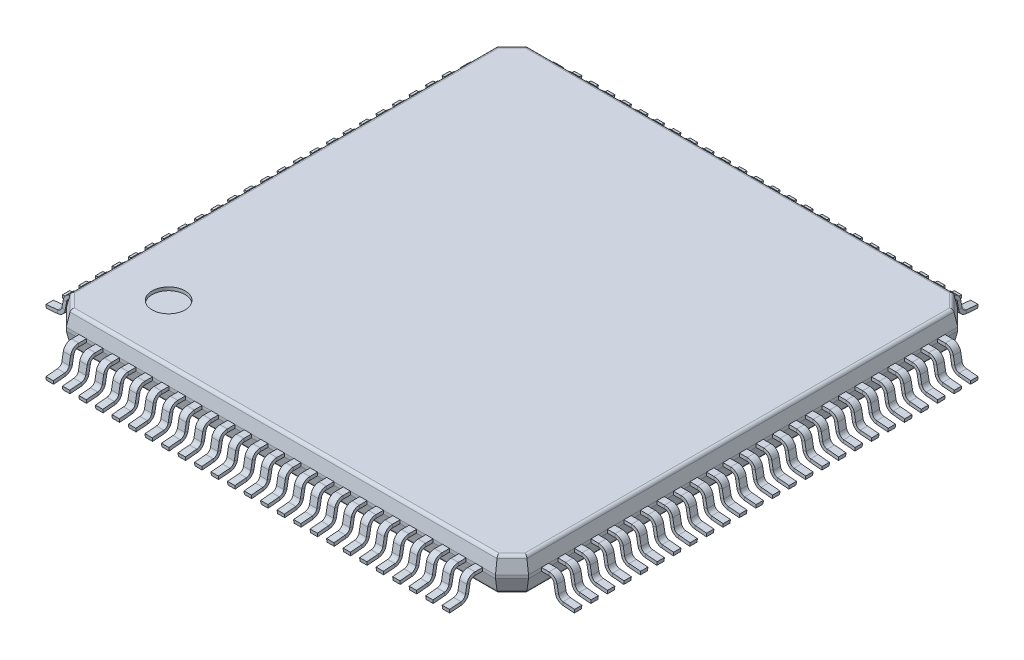
from build123d import *
from OCP.BRepFilletAPI import BRepFilletAPI_MakeChamfer

# Parameters (mm, degrees)
EXTRUDE_1_DEPTH           = 1
CHAMFER_1_SIZE            = 0.45
CHAMFER_1_SIZE2           = 0.095650453
CHAMFER_2_SIZE            = 0.45
CHAMFER_2_SIZE2           = 0.095650453
FILLET_1_R                = 0.1
SKETCH_2_R                = 0.5
CUT_EXTRUDE_1_DEPTH       = 0.1
SKETCH_4_W                = 0.22
SKETCH_4_H                = 0.1
PATTERN_LINEAR_1_COUNT    = 25
PATTERN_LINEAR_1_PITCH    = 0.5
MIRROR_1_COPY_1_SKETCH_W  = 0.22
MIRROR_1_COPY_1_SKETCH_H  = 0.1
MIRROR_1_COPY_2_SKETCH_W  = 0.22
MIRROR_1_COPY_2_SKETCH_H  = 0.1
MIRROR_1_COPY_3_SKETCH_W  = 0.22
MIRROR_1_COPY_3_SKETCH_H  = 0.1
MIRROR_1_COPY_4_SKETCH_W  = 0.22
MIRROR_1_COPY_4_SKETCH_H  = 0.1
MIRROR_1_COPY_5_SKETCH_W  = 0.22
MIRROR_1_COPY_5_SKETCH_H  = 0.1
MIRROR_1_COPY_6_SKETCH_W  = 0.22
MIRROR_1_COPY_6_SKETCH_H  = 0.1
MIRROR_1_COPY_7_SKETCH_W  = 0.22
MIRROR_1_COPY_7_SKETCH_H  = 0.1
MIRROR_1_COPY_8_SKETCH_W  = 0.22
MIRROR_1_COPY_8_SKETCH_H  = 0.1
MIRROR_1_COPY_9_SKETCH_W  = 0.22
MIRROR_1_COPY_9_SKETCH_H  = 0.1
MIRROR_1_COPY_10_SKETCH_W = 0.22
MIRROR_1_COPY_10_SKETCH_H = 0.1
MIRROR_1_COPY_11_SKETCH_W = 0.22
MIRROR_1_COPY_11_SKETCH_H = 0.1
MIRROR_1_COPY_12_SKETCH_W = 0.22
MIRROR_1_COPY_12_SKETCH_H = 0.1
MIRROR_1_COPY_13_SKETCH_W = 0.22
MIRROR_1_COPY_13_SKETCH_H = 0.1
MIRROR_1_COPY_14_SKETCH_W = 0.22
MIRROR_1_COPY_14_SKETCH_H = 0.1
MIRROR_1_COPY_15_SKETCH_W = 0.22
MIRROR_1_COPY_15_SKETCH_H = 0.1
MIRROR_1_COPY_16_SKETCH_W = 0.22
MIRROR_1_COPY_16_SKETCH_H = 0.1
MIRROR_1_COPY_17_SKETCH_W = 0.22
MIRROR_1_COPY_17_SKETCH_H = 0.1
MIRROR_1_COPY_18_SKETCH_W = 0.22
MIRROR_1_COPY_18_SKETCH_H = 0.1
MIRROR_1_COPY_19_SKETCH_W = 0.22
MIRROR_1_COPY_19_SKETCH_H = 0.1
MIRROR_1_COPY_20_SKETCH_W = 0.22
MIRROR_1_COPY_20_SKETCH_H = 0.1
MIRROR_1_COPY_21_SKETCH_W = 0.22
MIRROR_1_COPY_21_SKETCH_H = 0.1
MIRROR_1_COPY_22_SKETCH_W = 0.22
MIRROR_1_COPY_22_SKETCH_H = 0.1
MIRROR_1_COPY_23_SKETCH_W = 0.22
MIRROR_1_COPY_23_SKETCH_H = 0.1
MIRROR_1_COPY_24_SKETCH_W = 0.22
MIRROR_1_COPY_24_SKETCH_H = 0.1
PATTERN_LINEAR_2_COUNT    = 25
PATTERN_LINEAR_2_PITCH    = 0.5


with BuildPart() as part:
    # Эскиз1 → Бобышка-Вытянуть1 (new body)
    with BuildSketch(Plane(origin=(0, 0, 0), x_dir=(1, 0, 0), z_dir=(0, 1, 0))):
        Polygon((0, 13.5), (0.5, 14), (13.5, 14), (14, 13.5), (14, 0.5), (13.5, 0), (0.5, 0), (0, 0.5), align=None)
    extrude(amount=EXTRUDE_1_DEPTH)

    # Фаска1: one chamfer whose edges measure the first distance from different faces: ONE call of the kernel's chamfer builder (chamfer() names one face for all edges)
    chamfer_1_edges_1 = [part.edges().sort_by_distance(p)[0] for p in [
        (0.25, 1, -13.75),
    ]]
    chamfer_1_side_1 = [part.faces().sort_by_distance(p)[0] for p in [
        (0.25, 0.5, -13.75),
    ]]
    chamfer_1_edges_2 = [part.edges().sort_by_distance(p)[0] for p in [
        (7, 1, -14),
    ]]
    chamfer_1_side_2 = [part.faces().sort_by_distance(p)[0] for p in [
        (7, 0.5, -14),
    ]]
    chamfer_1_edges_3 = [part.edges().sort_by_distance(p)[0] for p in [
        (13.75, 1, -13.75),
    ]]
    chamfer_1_side_3 = [part.faces().sort_by_distance(p)[0] for p in [
        (13.75, 0.5, -13.75),
    ]]
    chamfer_1_edges_4 = [part.edges().sort_by_distance(p)[0] for p in [
        (14, 1, -7),
    ]]
    chamfer_1_side_4 = [part.faces().sort_by_distance(p)[0] for p in [
        (14, 0.5, -7),
    ]]
    chamfer_1_edges_5 = [part.edges().sort_by_distance(p)[0] for p in [
        (13.75, 1, -0.25),
    ]]
    chamfer_1_side_5 = [part.faces().sort_by_distance(p)[0] for p in [
        (13.75, 0.5, -0.25),
    ]]
    chamfer_1_edges_6 = [part.edges().sort_by_distance(p)[0] for p in [
        (7, 1, 0),
    ]]
    chamfer_1_side_6 = [part.faces().sort_by_distance(p)[0] for p in [
        (7, 0.5, 0),
    ]]
    chamfer_1_edges_7 = [part.edges().sort_by_distance(p)[0] for p in [
        (0.25, 1, -0.25),
    ]]
    chamfer_1_side_7 = [part.faces().sort_by_distance(p)[0] for p in [
        (0.25, 0.5, -0.25),
    ]]
    chamfer_1_edges_8 = [part.edges().sort_by_distance(p)[0] for p in [
        (0, 1, -7),
    ]]
    chamfer_1_side_8 = [part.faces().sort_by_distance(p)[0] for p in [
        (0, 0.5, -7),
    ]]
    chamfer_1 = BRepFilletAPI_MakeChamfer(part.part.solid().wrapped)
    for e in chamfer_1_edges_1:
        chamfer_1.Add(CHAMFER_1_SIZE, CHAMFER_1_SIZE2, e.wrapped, chamfer_1_side_1[0].wrapped)  # the first distance lies on this face
    for e in chamfer_1_edges_2:
        chamfer_1.Add(CHAMFER_1_SIZE, CHAMFER_1_SIZE2, e.wrapped, chamfer_1_side_2[0].wrapped)  # the first distance lies on this face
    for e in chamfer_1_edges_3:
        chamfer_1.Add(CHAMFER_1_SIZE, CHAMFER_1_SIZE2, e.wrapped, chamfer_1_side_3[0].wrapped)  # the first distance lies on this face
    for e in chamfer_1_edges_4:
        chamfer_1.Add(CHAMFER_1_SIZE, CHAMFER_1_SIZE2, e.wrapped, chamfer_1_side_4[0].wrapped)  # the first distance lies on this face
    for e in chamfer_1_edges_5:
        chamfer_1.Add(CHAMFER_1_SIZE, CHAMFER_1_SIZE2, e.wrapped, chamfer_1_side_5[0].wrapped)  # the first distance lies on this face
    for e in chamfer_1_edges_6:
        chamfer_1.Add(CHAMFER_1_SIZE, CHAMFER_1_SIZE2, e.wrapped, chamfer_1_side_6[0].wrapped)  # the first distance lies on this face
    for e in chamfer_1_edges_7:
        chamfer_1.Add(CHAMFER_1_SIZE, CHAMFER_1_SIZE2, e.wrapped, chamfer_1_side_7[0].wrapped)  # the first distance lies on this face
    for e in chamfer_1_edges_8:
        chamfer_1.Add(CHAMFER_1_SIZE, CHAMFER_1_SIZE2, e.wrapped, chamfer_1_side_8[0].wrapped)  # the first distance lies on this face
    add(Compound.cast(chamfer_1.Shape()), mode=Mode.REPLACE)

    # Фаска2: one chamfer whose edges measure the first distance from different faces: ONE call of the kernel's chamfer builder (chamfer() names one face for all edges)
    chamfer_2_edges_1 = [part.edges().sort_by_distance(p)[0] for p in [
        (0.25, 0, -0.25),
    ]]
    chamfer_2_side_1 = [part.faces().sort_by_distance(p)[0] for p in [
        (0.25, 0.275, -0.25),
    ]]
    chamfer_2_edges_2 = [part.edges().sort_by_distance(p)[0] for p in [
        (7, 0, 0),
    ]]
    chamfer_2_side_2 = [part.faces().sort_by_distance(p)[0] for p in [
        (7, 0.275, 0),
    ]]
    chamfer_2_edges_3 = [part.edges().sort_by_distance(p)[0] for p in [
        (13.75, 0, -0.25),
    ]]
    chamfer_2_side_3 = [part.faces().sort_by_distance(p)[0] for p in [
        (13.75, 0.275, -0.25),
    ]]
    chamfer_2_edges_4 = [part.edges().sort_by_distance(p)[0] for p in [
        (14, 0, -7),
    ]]
    chamfer_2_side_4 = [part.faces().sort_by_distance(p)[0] for p in [
        (14, 0.275, -7),
    ]]
    chamfer_2_edges_5 = [part.edges().sort_by_distance(p)[0] for p in [
        (13.75, 0, -13.75),
    ]]
    chamfer_2_side_5 = [part.faces().sort_by_distance(p)[0] for p in [
        (13.75, 0.275, -13.75),
    ]]
    chamfer_2_edges_6 = [part.edges().sort_by_distance(p)[0] for p in [
        (7, 0, -14),
    ]]
    chamfer_2_side_6 = [part.faces().sort_by_distance(p)[0] for p in [
        (7, 0.275, -14),
    ]]
    chamfer_2_edges_7 = [part.edges().sort_by_distance(p)[0] for p in [
        (0.25, 0, -13.75),
    ]]
    chamfer_2_side_7 = [part.faces().sort_by_distance(p)[0] for p in [
        (0.25, 0.275, -13.75),
    ]]
    chamfer_2_edges_8 = [part.edges().sort_by_distance(p)[0] for p in [
        (0, 0, -7),
    ]]
    chamfer_2_side_8 = [part.faces().sort_by_distance(p)[0] for p in [
        (0, 0.275, -7),
    ]]
    chamfer_2 = BRepFilletAPI_MakeChamfer(part.part.solid().wrapped)
    for e in chamfer_2_edges_1:
        chamfer_2.Add(CHAMFER_2_SIZE, CHAMFER_2_SIZE2, e.wrapped, chamfer_2_side_1[0].wrapped)  # the first distance lies on this face
    for e in chamfer_2_edges_2:
        chamfer_2.Add(CHAMFER_2_SIZE, CHAMFER_2_SIZE2, e.wrapped, chamfer_2_side_2[0].wrapped)  # the first distance lies on this face
    for e in chamfer_2_edges_3:
        chamfer_2.Add(CHAMFER_2_SIZE, CHAMFER_2_SIZE2, e.wrapped, chamfer_2_side_3[0].wrapped)  # the first distance lies on this face
    for e in chamfer_2_edges_4:
        chamfer_2.Add(CHAMFER_2_SIZE, CHAMFER_2_SIZE2, e.wrapped, chamfer_2_side_4[0].wrapped)  # the first distance lies on this face
    for e in chamfer_2_edges_5:
        chamfer_2.Add(CHAMFER_2_SIZE, CHAMFER_2_SIZE2, e.wrapped, chamfer_2_side_5[0].wrapped)  # the first distance lies on this face
    for e in chamfer_2_edges_6:
        chamfer_2.Add(CHAMFER_2_SIZE, CHAMFER_2_SIZE2, e.wrapped, chamfer_2_side_6[0].wrapped)  # the first distance lies on this face
    for e in chamfer_2_edges_7:
        chamfer_2.Add(CHAMFER_2_SIZE, CHAMFER_2_SIZE2, e.wrapped, chamfer_2_side_7[0].wrapped)  # the first distance lies on this face
    for e in chamfer_2_edges_8:
        chamfer_2.Add(CHAMFER_2_SIZE, CHAMFER_2_SIZE2, e.wrapped, chamfer_2_side_8[0].wrapped)  # the first distance lies on this face
    add(Compound.cast(chamfer_2.Shape()), mode=Mode.REPLACE)

    # Скругление1
    fillet_1_edges = [part.edges().sort_by_distance(p)[0] for p in [
        (13.682364916, 1, -13.682364916),
        (13.904349547, 1, -7),
        (13.682364916, 1, -0.317635084),
        (7, 1, -0.095650453),
        (0.317635084, 1, -0.317635084),
        (0.095650453, 1, -7),
        (0.317635084, 1, -13.682364916),
        (7, 1, -13.904349547),
        (13.682364916, 0, -0.317635084),
        (13.904349547, 0, -7),
        (13.682364916, 0, -13.682364916),
        (7, 0, -13.904349547),
        (0.317635084, 0, -13.682364916),
        (0.095650453, 0, -7),
        (0.317635084, 0, -0.317635084),
        (7, 0, -0.095650453),
    ]]
    fillet(fillet_1_edges, radius=FILLET_1_R)

    # Эскиз2 → Вырез-Вытянуть1 (cut)
    with BuildSketch(Plane(origin=(0, 1, 0), x_dir=(1, 0, 0), z_dir=(0, 1, 0))):
        with Locations((1.8, 1.8)):
            Circle(SKETCH_2_R)
    extrude(amount=-CUT_EXTRUDE_1_DEPTH, mode=Mode.SUBTRACT)

    # По траектории1: sweep along a path in Эскиз3
    with BuildLine(Plane.ZY.offset(-1)) as sweep_1_path:
        Line((0, 0.5), (0.232748539, 0.5))
        ThreePointArc((0.232748539, 0.5), (0.36104998, 0.453423402), (0.429592974, 0.335387403))
        Line((0.429592974, 0.335387403), (0.472940079, 0.094266676))
        ThreePointArc((0.472940079, 0.094266676), (0.534912953, -0.018026868), (0.652353366, -0.069584861))
        Line((0.652353366, -0.069584861), (1, -0.1))
    # Эскиз4 → По траектории1 (sweep)
    with BuildSketch(Plane.XY):
        with Locations((1, 0.5)):
            Rectangle(SKETCH_4_W, SKETCH_4_H)
    sweep_1 = sweep(path=sweep_1_path.line)

    # Линейный массив1: По траектории1 ×25
    with Locations(*[(i * PATTERN_LINEAR_1_PITCH, 0, 0) for i in range(1, PATTERN_LINEAR_1_COUNT)]):
        add(sweep_1)

    # Зеркальное отражение1: По траектории1 across plane
    add(sweep_1.mirror(Plane(origin=(0, 0, -7), x_dir=(1, 0, 0), z_dir=(0, 0, -1))))

    # Зеркальное отражение1 copy 1: sweep along a path in Зеркальное отражение1 copy 1 path
    with BuildLine(Plane(origin=(1.5, 0, -14), x_dir=(0, 0, -1), z_dir=(-1, 0, 0))) as mirror_1_copy_1_path:
        Line((0, -0.5), (0.232748539, -0.5))
        ThreePointArc((0.232748539, -0.5), (0.36104998, -0.453423402), (0.429592974, -0.335387403))
        Line((0.429592974, -0.335387403), (0.472940079, -0.094266676))
        ThreePointArc((0.472940079, -0.094266676), (0.534912953, 0.018026868), (0.652353366, 0.069584861))
        Line((0.652353366, 0.069584861), (1, 0.1))
    # Зеркальное отражение1 copy 1 sketch → Зеркальное отражение1 copy 1 (sweep)
    with BuildSketch(Plane(origin=(0.5, 0, -14), x_dir=(1, 0, 0), z_dir=(0, 0, -1))):
        with Locations((1, -0.5)):
            Rectangle(MIRROR_1_COPY_1_SKETCH_W, MIRROR_1_COPY_1_SKETCH_H)
    sweep(path=mirror_1_copy_1_path.line)

    # Зеркальное отражение1 copy 2: sweep along a path in Зеркальное отражение1 copy 2 path
    with BuildLine(Plane(origin=(2, 0, -14), x_dir=(0, 0, -1), z_dir=(-1, 0, 0))) as mirror_1_copy_2_path:
        Line((0, -0.5), (0.232748539, -0.5))
        ThreePointArc((0.232748539, -0.5), (0.36104998, -0.453423402), (0.429592974, -0.335387403))
        Line((0.429592974, -0.335387403), (0.472940079, -0.094266676))
        ThreePointArc((0.472940079, -0.094266676), (0.534912953, 0.018026868), (0.652353366, 0.069584861))
        Line((0.652353366, 0.069584861), (1, 0.1))
    # Зеркальное отражение1 copy 2 sketch → Зеркальное отражение1 copy 2 (sweep)
    with BuildSketch(Plane(origin=(1, 0, -14), x_dir=(1, 0, 0), z_dir=(0, 0, -1))):
        with Locations((1, -0.5)):
            Rectangle(MIRROR_1_COPY_2_SKETCH_W, MIRROR_1_COPY_2_SKETCH_H)
    sweep(path=mirror_1_copy_2_path.line)

    # Зеркальное отражение1 copy 3: sweep along a path in Зеркальное отражение1 copy 3 path
    with BuildLine(Plane(origin=(2.5, 0, -14), x_dir=(0, 0, -1), z_dir=(-1, 0, 0))) as mirror_1_copy_3_path:
        Line((0, -0.5), (0.232748539, -0.5))
        ThreePointArc((0.232748539, -0.5), (0.36104998, -0.453423402), (0.429592974, -0.335387403))
        Line((0.429592974, -0.335387403), (0.472940079, -0.094266676))
        ThreePointArc((0.472940079, -0.094266676), (0.534912953, 0.018026868), (0.652353366, 0.069584861))
        Line((0.652353366, 0.069584861), (1, 0.1))
    # Зеркальное отражение1 copy 3 sketch → Зеркальное отражение1 copy 3 (sweep)
    with BuildSketch(Plane(origin=(1.5, 0, -14), x_dir=(1, 0, 0), z_dir=(0, 0, -1))):
        with Locations((1, -0.5)):
            Rectangle(MIRROR_1_COPY_3_SKETCH_W, MIRROR_1_COPY_3_SKETCH_H)
    sweep(path=mirror_1_copy_3_path.line)

    # Зеркальное отражение1 copy 4: sweep along a path in Зеркальное отражение1 copy 4 path
    with BuildLine(Plane(origin=(3, 0, -14), x_dir=(0, 0, -1), z_dir=(-1, 0, 0))) as mirror_1_copy_4_path:
        Line((0, -0.5), (0.232748539, -0.5))
        ThreePointArc((0.232748539, -0.5), (0.36104998, -0.453423402), (0.429592974, -0.335387403))
        Line((0.429592974, -0.335387403), (0.472940079, -0.094266676))
        ThreePointArc((0.472940079, -0.094266676), (0.534912953, 0.018026868), (0.652353366, 0.069584861))
        Line((0.652353366, 0.069584861), (1, 0.1))
    # Зеркальное отражение1 copy 4 sketch → Зеркальное отражение1 copy 4 (sweep)
    with BuildSketch(Plane(origin=(2, 0, -14), x_dir=(1, 0, 0), z_dir=(0, 0, -1))):
        with Locations((1, -0.5)):
            Rectangle(MIRROR_1_COPY_4_SKETCH_W, MIRROR_1_COPY_4_SKETCH_H)
    sweep(path=mirror_1_copy_4_path.line)

    # Зеркальное отражение1 copy 5: sweep along a path in Зеркальное отражение1 copy 5 path
    with BuildLine(Plane(origin=(3.5, 0, -14), x_dir=(0, 0, -1), z_dir=(-1, 0, 0))) as mirror_1_copy_5_path:
        Line((0, -0.5), (0.232748539, -0.5))
        ThreePointArc((0.232748539, -0.5), (0.36104998, -0.453423402), (0.429592974, -0.335387403))
        Line((0.429592974, -0.335387403), (0.472940079, -0.094266676))
        ThreePointArc((0.472940079, -0.094266676), (0.534912953, 0.018026868), (0.652353366, 0.069584861))
        Line((0.652353366, 0.069584861), (1, 0.1))
    # Зеркальное отражение1 copy 5 sketch → Зеркальное отражение1 copy 5 (sweep)
    with BuildSketch(Plane(origin=(2.5, 0, -14), x_dir=(1, 0, 0), z_dir=(0, 0, -1))):
        with Locations((1, -0.5)):
            Rectangle(MIRROR_1_COPY_5_SKETCH_W, MIRROR_1_COPY_5_SKETCH_H)
    sweep(path=mirror_1_copy_5_path.line)

    # Зеркальное отражение1 copy 6: sweep along a path in Зеркальное отражение1 copy 6 path
    with BuildLine(Plane(origin=(4, 0, -14), x_dir=(0, 0, -1), z_dir=(-1, 0, 0))) as mirror_1_copy_6_path:
        Line((0, -0.5), (0.232748539, -0.5))
        ThreePointArc((0.232748539, -0.5), (0.36104998, -0.453423402), (0.429592974, -0.335387403))
        Line((0.429592974, -0.335387403), (0.472940079, -0.094266676))
        ThreePointArc((0.472940079, -0.094266676), (0.534912953, 0.018026868), (0.652353366, 0.069584861))
        Line((0.652353366, 0.069584861), (1, 0.1))
    # Зеркальное отражение1 copy 6 sketch → Зеркальное отражение1 copy 6 (sweep)
    with BuildSketch(Plane(origin=(3, 0, -14), x_dir=(1, 0, 0), z_dir=(0, 0, -1))):
        with Locations((1, -0.5)):
            Rectangle(MIRROR_1_COPY_6_SKETCH_W, MIRROR_1_COPY_6_SKETCH_H)
    sweep(path=mirror_1_copy_6_path.line)

    # Зеркальное отражение1 copy 7: sweep along a path in Зеркальное отражение1 copy 7 path
    with BuildLine(Plane(origin=(4.5, 0, -14), x_dir=(0, 0, -1), z_dir=(-1, 0, 0))) as mirror_1_copy_7_path:
        Line((0, -0.5), (0.232748539, -0.5))
        ThreePointArc((0.232748539, -0.5), (0.36104998, -0.453423402), (0.429592974, -0.335387403))
        Line((0.429592974, -0.335387403), (0.472940079, -0.094266676))
        ThreePointArc((0.472940079, -0.094266676), (0.534912953, 0.018026868), (0.652353366, 0.069584861))
        Line((0.652353366, 0.069584861), (1, 0.1))
    # Зеркальное отражение1 copy 7 sketch → Зеркальное отражение1 copy 7 (sweep)
    with BuildSketch(Plane(origin=(3.5, 0, -14), x_dir=(1, 0, 0), z_dir=(0, 0, -1))):
        with Locations((1, -0.5)):
            Rectangle(MIRROR_1_COPY_7_SKETCH_W, MIRROR_1_COPY_7_SKETCH_H)
    sweep(path=mirror_1_copy_7_path.line)

    # Зеркальное отражение1 copy 8: sweep along a path in Зеркальное отражение1 copy 8 path
    with BuildLine(Plane(origin=(5, 0, -14), x_dir=(0, 0, -1), z_dir=(-1, 0, 0))) as mirror_1_copy_8_path:
        Line((0, -0.5), (0.232748539, -0.5))
        ThreePointArc((0.232748539, -0.5), (0.36104998, -0.453423402), (0.429592974, -0.335387403))
        Line((0.429592974, -0.335387403), (0.472940079, -0.094266676))
        ThreePointArc((0.472940079, -0.094266676), (0.534912953, 0.018026868), (0.652353366, 0.069584861))
        Line((0.652353366, 0.069584861), (1, 0.1))
    # Зеркальное отражение1 copy 8 sketch → Зеркальное отражение1 copy 8 (sweep)
    with BuildSketch(Plane(origin=(4, 0, -14), x_dir=(1, 0, 0), z_dir=(0, 0, -1))):
        with Locations((1, -0.5)):
            Rectangle(MIRROR_1_COPY_8_SKETCH_W, MIRROR_1_COPY_8_SKETCH_H)
    sweep(path=mirror_1_copy_8_path.line)

    # Зеркальное отражение1 copy 9: sweep along a path in Зеркальное отражение1 copy 9 path
    with BuildLine(Plane(origin=(5.5, 0, -14), x_dir=(0, 0, -1), z_dir=(-1, 0, 0))) as mirror_1_copy_9_path:
        Line((0, -0.5), (0.232748539, -0.5))
        ThreePointArc((0.232748539, -0.5), (0.36104998, -0.453423402), (0.429592974, -0.335387403))
        Line((0.429592974, -0.335387403), (0.472940079, -0.094266676))
        ThreePointArc((0.472940079, -0.094266676), (0.534912953, 0.018026868), (0.652353366, 0.069584861))
        Line((0.652353366, 0.069584861), (1, 0.1))
    # Зеркальное отражение1 copy 9 sketch → Зеркальное отражение1 copy 9 (sweep)
    with BuildSketch(Plane(origin=(4.5, 0, -14), x_dir=(1, 0, 0), z_dir=(0, 0, -1))):
        with Locations((1, -0.5)):
            Rectangle(MIRROR_1_COPY_9_SKETCH_W, MIRROR_1_COPY_9_SKETCH_H)
    sweep(path=mirror_1_copy_9_path.line)

    # Зеркальное отражение1 copy 10: sweep along a path in Зеркальное отражение1 copy 10 path
    with BuildLine(Plane(origin=(6, 0, -14), x_dir=(0, 0, -1), z_dir=(-1, 0, 0))) as mirror_1_copy_10_path:
        Line((0, -0.5), (0.232748539, -0.5))
        ThreePointArc((0.232748539, -0.5), (0.36104998, -0.453423402), (0.429592974, -0.335387403))
        Line((0.429592974, -0.335387403), (0.472940079, -0.094266676))
        ThreePointArc((0.472940079, -0.094266676), (0.534912953, 0.018026868), (0.652353366, 0.069584861))
        Line((0.652353366, 0.069584861), (1, 0.1))
    # Зеркальное отражение1 copy 10 sketch → Зеркальное отражение1 copy 10 (sweep)
    with BuildSketch(Plane(origin=(5, 0, -14), x_dir=(1, 0, 0), z_dir=(0, 0, -1))):
        with Locations((1, -0.5)):
            Rectangle(MIRROR_1_COPY_10_SKETCH_W, MIRROR_1_COPY_10_SKETCH_H)
    sweep(path=mirror_1_copy_10_path.line)

    # Зеркальное отражение1 copy 11: sweep along a path in Зеркальное отражение1 copy 11 path
    with BuildLine(Plane(origin=(6.5, 0, -14), x_dir=(0, 0, -1), z_dir=(-1, 0, 0))) as mirror_1_copy_11_path:
        Line((0, -0.5), (0.232748539, -0.5))
        ThreePointArc((0.232748539, -0.5), (0.36104998, -0.453423402), (0.429592974, -0.335387403))
        Line((0.429592974, -0.335387403), (0.472940079, -0.094266676))
        ThreePointArc((0.472940079, -0.094266676), (0.534912953, 0.018026868), (0.652353366, 0.069584861))
        Line((0.652353366, 0.069584861), (1, 0.1))
    # Зеркальное отражение1 copy 11 sketch → Зеркальное отражение1 copy 11 (sweep)
    with BuildSketch(Plane(origin=(5.5, 0, -14), x_dir=(1, 0, 0), z_dir=(0, 0, -1))):
        with Locations((1, -0.5)):
            Rectangle(MIRROR_1_COPY_11_SKETCH_W, MIRROR_1_COPY_11_SKETCH_H)
    sweep(path=mirror_1_copy_11_path.line)

    # Зеркальное отражение1 copy 12: sweep along a path in Зеркальное отражение1 copy 12 path
    with BuildLine(Plane(origin=(7, 0, -14), x_dir=(0, 0, -1), z_dir=(-1, 0, 0))) as mirror_1_copy_12_path:
        Line((0, -0.5), (0.232748539, -0.5))
        ThreePointArc((0.232748539, -0.5), (0.36104998, -0.453423402), (0.429592974, -0.335387403))
        Line((0.429592974, -0.335387403), (0.472940079, -0.094266676))
        ThreePointArc((0.472940079, -0.094266676), (0.534912953, 0.018026868), (0.652353366, 0.069584861))
        Line((0.652353366, 0.069584861), (1, 0.1))
    # Зеркальное отражение1 copy 12 sketch → Зеркальное отражение1 copy 12 (sweep)
    with BuildSketch(Plane(origin=(6, 0, -14), x_dir=(1, 0, 0), z_dir=(0, 0, -1))):
        with Locations((1, -0.5)):
            Rectangle(MIRROR_1_COPY_12_SKETCH_W, MIRROR_1_COPY_12_SKETCH_H)
    sweep(path=mirror_1_copy_12_path.line)

    # Зеркальное отражение1 copy 13: sweep along a path in Зеркальное отражение1 copy 13 path
    with BuildLine(Plane(origin=(7.5, 0, -14), x_dir=(0, 0, -1), z_dir=(-1, 0, 0))) as mirror_1_copy_13_path:
        Line((0, -0.5), (0.232748539, -0.5))
        ThreePointArc((0.232748539, -0.5), (0.36104998, -0.453423402), (0.429592974, -0.335387403))
        Line((0.429592974, -0.335387403), (0.472940079, -0.094266676))
        ThreePointArc((0.472940079, -0.094266676), (0.534912953, 0.018026868), (0.652353366, 0.069584861))
        Line((0.652353366, 0.069584861), (1, 0.1))
    # Зеркальное отражение1 copy 13 sketch → Зеркальное отражение1 copy 13 (sweep)
    with BuildSketch(Plane(origin=(6.5, 0, -14), x_dir=(1, 0, 0), z_dir=(0, 0, -1))):
        with Locations((1, -0.5)):
            Rectangle(MIRROR_1_COPY_13_SKETCH_W, MIRROR_1_COPY_13_SKETCH_H)
    sweep(path=mirror_1_copy_13_path.line)

    # Зеркальное отражение1 copy 14: sweep along a path in Зеркальное отражение1 copy 14 path
    with BuildLine(Plane(origin=(8, 0, -14), x_dir=(0, 0, -1), z_dir=(-1, 0, 0))) as mirror_1_copy_14_path:
        Line((0, -0.5), (0.232748539, -0.5))
        ThreePointArc((0.232748539, -0.5), (0.36104998, -0.453423402), (0.429592974, -0.335387403))
        Line((0.429592974, -0.335387403), (0.472940079, -0.094266676))
        ThreePointArc((0.472940079, -0.094266676), (0.534912953, 0.018026868), (0.652353366, 0.069584861))
        Line((0.652353366, 0.069584861), (1, 0.1))
    # Зеркальное отражение1 copy 14 sketch → Зеркальное отражение1 copy 14 (sweep)
    with BuildSketch(Plane(origin=(7, 0, -14), x_dir=(1, 0, 0), z_dir=(0, 0, -1))):
        with Locations((1, -0.5)):
            Rectangle(MIRROR_1_COPY_14_SKETCH_W, MIRROR_1_COPY_14_SKETCH_H)
    sweep(path=mirror_1_copy_14_path.line)

    # Зеркальное отражение1 copy 15: sweep along a path in Зеркальное отражение1 copy 15 path
    with BuildLine(Plane(origin=(8.5, 0, -14), x_dir=(0, 0, -1), z_dir=(-1, 0, 0))) as mirror_1_copy_15_path:
        Line((0, -0.5), (0.232748539, -0.5))
        ThreePointArc((0.232748539, -0.5), (0.36104998, -0.453423402), (0.429592974, -0.335387403))
        Line((0.429592974, -0.335387403), (0.472940079, -0.094266676))
        ThreePointArc((0.472940079, -0.094266676), (0.534912953, 0.018026868), (0.652353366, 0.069584861))
        Line((0.652353366, 0.069584861), (1, 0.1))
    # Зеркальное отражение1 copy 15 sketch → Зеркальное отражение1 copy 15 (sweep)
    with BuildSketch(Plane(origin=(7.5, 0, -14), x_dir=(1, 0, 0), z_dir=(0, 0, -1))):
        with Locations((1, -0.5)):
            Rectangle(MIRROR_1_COPY_15_SKETCH_W, MIRROR_1_COPY_15_SKETCH_H)
    sweep(path=mirror_1_copy_15_path.line)

    # Зеркальное отражение1 copy 16: sweep along a path in Зеркальное отражение1 copy 16 path
    with BuildLine(Plane(origin=(9, 0, -14), x_dir=(0, 0, -1), z_dir=(-1, 0, 0))) as mirror_1_copy_16_path:
        Line((0, -0.5), (0.232748539, -0.5))
        ThreePointArc((0.232748539, -0.5), (0.36104998, -0.453423402), (0.429592974, -0.335387403))
        Line((0.429592974, -0.335387403), (0.472940079, -0.094266676))
        ThreePointArc((0.472940079, -0.094266676), (0.534912953, 0.018026868), (0.652353366, 0.069584861))
        Line((0.652353366, 0.069584861), (1, 0.1))
    # Зеркальное отражение1 copy 16 sketch → Зеркальное отражение1 copy 16 (sweep)
    with BuildSketch(Plane(origin=(8, 0, -14), x_dir=(1, 0, 0), z_dir=(0, 0, -1))):
        with Locations((1, -0.5)):
            Rectangle(MIRROR_1_COPY_16_SKETCH_W, MIRROR_1_COPY_16_SKETCH_H)
    sweep(path=mirror_1_copy_16_path.line)

    # Зеркальное отражение1 copy 17: sweep along a path in Зеркальное отражение1 copy 17 path
    with BuildLine(Plane(origin=(9.5, 0, -14), x_dir=(0, 0, -1), z_dir=(-1, 0, 0))) as mirror_1_copy_17_path:
        Line((0, -0.5), (0.232748539, -0.5))
        ThreePointArc((0.232748539, -0.5), (0.36104998, -0.453423402), (0.429592974, -0.335387403))
        Line((0.429592974, -0.335387403), (0.472940079, -0.094266676))
        ThreePointArc((0.472940079, -0.094266676), (0.534912953, 0.018026868), (0.652353366, 0.069584861))
        Line((0.652353366, 0.069584861), (1, 0.1))
    # Зеркальное отражение1 copy 17 sketch → Зеркальное отражение1 copy 17 (sweep)
    with BuildSketch(Plane(origin=(8.5, 0, -14), x_dir=(1, 0, 0), z_dir=(0, 0, -1))):
        with Locations((1, -0.5)):
            Rectangle(MIRROR_1_COPY_17_SKETCH_W, MIRROR_1_COPY_17_SKETCH_H)
    sweep(path=mirror_1_copy_17_path.line)

    # Зеркальное отражение1 copy 18: sweep along a path in Зеркальное отражение1 copy 18 path
    with BuildLine(Plane(origin=(10, 0, -14), x_dir=(0, 0, -1), z_dir=(-1, 0, 0))) as mirror_1_copy_18_path:
        Line((0, -0.5), (0.232748539, -0.5))
        ThreePointArc((0.232748539, -0.5), (0.36104998, -0.453423402), (0.429592974, -0.335387403))
        Line((0.429592974, -0.335387403), (0.472940079, -0.094266676))
        ThreePointArc((0.472940079, -0.094266676), (0.534912953, 0.018026868), (0.652353366, 0.069584861))
        Line((0.652353366, 0.069584861), (1, 0.1))
    # Зеркальное отражение1 copy 18 sketch → Зеркальное отражение1 copy 18 (sweep)
    with BuildSketch(Plane(origin=(9, 0, -14), x_dir=(1, 0, 0), z_dir=(0, 0, -1))):
        with Locations((1, -0.5)):
            Rectangle(MIRROR_1_COPY_18_SKETCH_W, MIRROR_1_COPY_18_SKETCH_H)
    sweep(path=mirror_1_copy_18_path.line)

    # Зеркальное отражение1 copy 19: sweep along a path in Зеркальное отражение1 copy 19 path
    with BuildLine(Plane(origin=(10.5, 0, -14), x_dir=(0, 0, -1), z_dir=(-1, 0, 0))) as mirror_1_copy_19_path:
        Line((0, -0.5), (0.232748539, -0.5))
        ThreePointArc((0.232748539, -0.5), (0.36104998, -0.453423402), (0.429592974, -0.335387403))
        Line((0.429592974, -0.335387403), (0.472940079, -0.094266676))
        ThreePointArc((0.472940079, -0.094266676), (0.534912953, 0.018026868), (0.652353366, 0.069584861))
        Line((0.652353366, 0.069584861), (1, 0.1))
    # Зеркальное отражение1 copy 19 sketch → Зеркальное отражение1 copy 19 (sweep)
    with BuildSketch(Plane(origin=(9.5, 0, -14), x_dir=(1, 0, 0), z_dir=(0, 0, -1))):
        with Locations((1, -0.5)):
            Rectangle(MIRROR_1_COPY_19_SKETCH_W, MIRROR_1_COPY_19_SKETCH_H)
    sweep(path=mirror_1_copy_19_path.line)

    # Зеркальное отражение1 copy 20: sweep along a path in Зеркальное отражение1 copy 20 path
    with BuildLine(Plane(origin=(11, 0, -14), x_dir=(0, 0, -1), z_dir=(-1, 0, 0))) as mirror_1_copy_20_path:
        Line((0, -0.5), (0.232748539, -0.5))
        ThreePointArc((0.232748539, -0.5), (0.36104998, -0.453423402), (0.429592974, -0.335387403))
        Line((0.429592974, -0.335387403), (0.472940079, -0.094266676))
        ThreePointArc((0.472940079, -0.094266676), (0.534912953, 0.018026868), (0.652353366, 0.069584861))
        Line((0.652353366, 0.069584861), (1, 0.1))
    # Зеркальное отражение1 copy 20 sketch → Зеркальное отражение1 copy 20 (sweep)
    with BuildSketch(Plane(origin=(10, 0, -14), x_dir=(1, 0, 0), z_dir=(0, 0, -1))):
        with Locations((1, -0.5)):
            Rectangle(MIRROR_1_COPY_20_SKETCH_W, MIRROR_1_COPY_20_SKETCH_H)
    sweep(path=mirror_1_copy_20_path.line)

    # Зеркальное отражение1 copy 21: sweep along a path in Зеркальное отражение1 copy 21 path
    with BuildLine(Plane(origin=(11.5, 0, -14), x_dir=(0, 0, -1), z_dir=(-1, 0, 0))) as mirror_1_copy_21_path:
        Line((0, -0.5), (0.232748539, -0.5))
        ThreePointArc((0.232748539, -0.5), (0.36104998, -0.453423402), (0.429592974, -0.335387403))
        Line((0.429592974, -0.335387403), (0.472940079, -0.094266676))
        ThreePointArc((0.472940079, -0.094266676), (0.534912953, 0.018026868), (0.652353366, 0.069584861))
        Line((0.652353366, 0.069584861), (1, 0.1))
    # Зеркальное отражение1 copy 21 sketch → Зеркальное отражение1 copy 21 (sweep)
    with BuildSketch(Plane(origin=(10.5, 0, -14), x_dir=(1, 0, 0), z_dir=(0, 0, -1))):
        with Locations((1, -0.5)):
            Rectangle(MIRROR_1_COPY_21_SKETCH_W, MIRROR_1_COPY_21_SKETCH_H)
    sweep(path=mirror_1_copy_21_path.line)

    # Зеркальное отражение1 copy 22: sweep along a path in Зеркальное отражение1 copy 22 path
    with BuildLine(Plane(origin=(12, 0, -14), x_dir=(0, 0, -1), z_dir=(-1, 0, 0))) as mirror_1_copy_22_path:
        Line((0, -0.5), (0.232748539, -0.5))
        ThreePointArc((0.232748539, -0.5), (0.36104998, -0.453423402), (0.429592974, -0.335387403))
        Line((0.429592974, -0.335387403), (0.472940079, -0.094266676))
        ThreePointArc((0.472940079, -0.094266676), (0.534912953, 0.018026868), (0.652353366, 0.069584861))
        Line((0.652353366, 0.069584861), (1, 0.1))
    # Зеркальное отражение1 copy 22 sketch → Зеркальное отражение1 copy 22 (sweep)
    with BuildSketch(Plane(origin=(11, 0, -14), x_dir=(1, 0, 0), z_dir=(0, 0, -1))):
        with Locations((1, -0.5)):
            Rectangle(MIRROR_1_COPY_22_SKETCH_W, MIRROR_1_COPY_22_SKETCH_H)
    sweep(path=mirror_1_copy_22_path.line)

    # Зеркальное отражение1 copy 23: sweep along a path in Зеркальное отражение1 copy 23 path
    with BuildLine(Plane(origin=(12.5, 0, -14), x_dir=(0, 0, -1), z_dir=(-1, 0, 0))) as mirror_1_copy_23_path:
        Line((0, -0.5), (0.232748539, -0.5))
        ThreePointArc((0.232748539, -0.5), (0.36104998, -0.453423402), (0.429592974, -0.335387403))
        Line((0.429592974, -0.335387403), (0.472940079, -0.094266676))
        ThreePointArc((0.472940079, -0.094266676), (0.534912953, 0.018026868), (0.652353366, 0.069584861))
        Line((0.652353366, 0.069584861), (1, 0.1))
    # Зеркальное отражение1 copy 23 sketch → Зеркальное отражение1 copy 23 (sweep)
    with BuildSketch(Plane(origin=(11.5, 0, -14), x_dir=(1, 0, 0), z_dir=(0, 0, -1))):
        with Locations((1, -0.5)):
            Rectangle(MIRROR_1_COPY_23_SKETCH_W, MIRROR_1_COPY_23_SKETCH_H)
    sweep(path=mirror_1_copy_23_path.line)

    # Зеркальное отражение1 copy 24: sweep along a path in Зеркальное отражение1 copy 24 path
    with BuildLine(Plane(origin=(13, 0, -14), x_dir=(0, 0, -1), z_dir=(-1, 0, 0))) as mirror_1_copy_24_path:
        Line((0, -0.5), (0.232748539, -0.5))
        ThreePointArc((0.232748539, -0.5), (0.36104998, -0.453423402), (0.429592974, -0.335387403))
        Line((0.429592974, -0.335387403), (0.472940079, -0.094266676))
        ThreePointArc((0.472940079, -0.094266676), (0.534912953, 0.018026868), (0.652353366, 0.069584861))
        Line((0.652353366, 0.069584861), (1, 0.1))
    # Зеркальное отражение1 copy 24 sketch → Зеркальное отражение1 copy 24 (sweep)
    with BuildSketch(Plane(origin=(12, 0, -14), x_dir=(1, 0, 0), z_dir=(0, 0, -1))):
        with Locations((1, -0.5)):
            Rectangle(MIRROR_1_COPY_24_SKETCH_W, MIRROR_1_COPY_24_SKETCH_H)
    sweep(path=mirror_1_copy_24_path.line)

    # По траектории2: sweep along a path in Эскиз6
    with BuildLine(Plane.XY.offset(-1)) as sweep_2_path:
        Line((14, 0.5), (14.232748539, 0.5))
        ThreePointArc((14.232748539, 0.5), (14.36104998, 0.453423402), (14.429592974, 0.335387403))
        Line((14.429592974, 0.335387403), (14.472940079, 0.094266676))
        ThreePointArc((14.472940079, 0.094266676), (14.534912953, -0.018026868), (14.652353366, -0.069584861))
        Line((14.652353366, -0.069584861), (15, -0.1))
    # Эскиз5 → По траектории2 (sweep)
    with BuildSketch(Plane(origin=(14, -0.127758876, 1.890971068), x_dir=(0, 0.08715574274765132, -0.9961946980917462), z_dir=(1, 0, 0))):
        Polygon((2.820743638, 0.33318273), (3.039906471, 0.314008467), (3.048622046, 0.413627937), (2.829459212, 0.4328022), align=None)
    sweep_2 = sweep(path=sweep_2_path.line)

    # Линейный массив2: По траектории2 ×25
    with Locations(*[(0, 0, -i * PATTERN_LINEAR_2_PITCH) for i in range(1, PATTERN_LINEAR_2_COUNT)]):
        add(sweep_2)

    # Зеркальное отражение2: По траектории2 across plane
    add(sweep_2.mirror(Plane(origin=(7, 0, 0), x_dir=(0, 0, 1), z_dir=(1, 0, 0))))

    # Зеркальное отражение2 copy 1: sweep along a path in Зеркальное отражение2 copy 1 path
    with BuildLine(Plane(origin=(14, 0, -1.5), x_dir=(-1, 0, 0), z_dir=(0, 0, 1))) as mirror_2_copy_1_path:
        Line((14, -0.5), (14.232748539, -0.5))
        ThreePointArc((14.232748539, -0.5), (14.36104998, -0.453423402), (14.429592974, -0.335387403))
        Line((14.429592974, -0.335387403), (14.472940079, -0.094266676))
        ThreePointArc((14.472940079, -0.094266676), (14.534912953, 0.018026868), (14.652353366, 0.069584861))
        Line((14.652353366, 0.069584861), (15, 0.1))
    # Зеркальное отражение2 copy 1 sketch → Зеркальное отражение2 copy 1 (sweep)
    with BuildSketch(Plane(origin=(0, -0.127758876, 1.390971068), x_dir=(0, 0.08715574274765132, -0.9961946980917462), z_dir=(-1, 0, 0))):
        Polygon((2.820743638, -0.33318273), (3.039906471, -0.314008467), (3.048622046, -0.413627937), (2.829459212, -0.4328022), align=None)
    sweep(path=mirror_2_copy_1_path.line)

    # Зеркальное отражение2 copy 2: sweep along a path in Зеркальное отражение2 copy 2 path
    with BuildLine(Plane(origin=(14, 0, -2), x_dir=(-1, 0, 0), z_dir=(0, 0, 1))) as mirror_2_copy_2_path:
        Line((14, -0.5), (14.232748539, -0.5))
        ThreePointArc((14.232748539, -0.5), (14.36104998, -0.453423402), (14.429592974, -0.335387403))
        Line((14.429592974, -0.335387403), (14.472940079, -0.094266676))
        ThreePointArc((14.472940079, -0.094266676), (14.534912953, 0.018026868), (14.652353366, 0.069584861))
        Line((14.652353366, 0.069584861), (15, 0.1))
    # Зеркальное отражение2 copy 2 sketch → Зеркальное отражение2 copy 2 (sweep)
    with BuildSketch(Plane(origin=(0, -0.127758876, 0.890971068), x_dir=(0, 0.08715574274765132, -0.9961946980917462), z_dir=(-1, 0, 0))):
        Polygon((2.820743638, -0.33318273), (3.039906471, -0.314008467), (3.048622046, -0.413627937), (2.829459212, -0.4328022), align=None)
    sweep(path=mirror_2_copy_2_path.line)

    # Зеркальное отражение2 copy 3: sweep along a path in Зеркальное отражение2 copy 3 path
    with BuildLine(Plane(origin=(14, 0, -2.5), x_dir=(-1, 0, 0), z_dir=(0, 0, 1))) as mirror_2_copy_3_path:
        Line((14, -0.5), (14.232748539, -0.5))
        ThreePointArc((14.232748539, -0.5), (14.36104998, -0.453423402), (14.429592974, -0.335387403))
        Line((14.429592974, -0.335387403), (14.472940079, -0.094266676))
        ThreePointArc((14.472940079, -0.094266676), (14.534912953, 0.018026868), (14.652353366, 0.069584861))
        Line((14.652353366, 0.069584861), (15, 0.1))
    # Зеркальное отражение2 copy 3 sketch → Зеркальное отражение2 copy 3 (sweep)
    with BuildSketch(Plane(origin=(0, -0.127758876, 0.390971068), x_dir=(0, 0.08715574274765132, -0.9961946980917462), z_dir=(-1, 0, 0))):
        Polygon((2.820743638, -0.33318273), (3.039906471, -0.314008467), (3.048622046, -0.413627937), (2.829459212, -0.4328022), align=None)
    sweep(path=mirror_2_copy_3_path.line)

    # Зеркальное отражение2 copy 4: sweep along a path in Зеркальное отражение2 copy 4 path
    with BuildLine(Plane(origin=(14, 0, -3), x_dir=(-1, 0, 0), z_dir=(0, 0, 1))) as mirror_2_copy_4_path:
        Line((14, -0.5), (14.232748539, -0.5))
        ThreePointArc((14.232748539, -0.5), (14.36104998, -0.453423402), (14.429592974, -0.335387403))
        Line((14.429592974, -0.335387403), (14.472940079, -0.094266676))
        ThreePointArc((14.472940079, -0.094266676), (14.534912953, 0.018026868), (14.652353366, 0.069584861))
        Line((14.652353366, 0.069584861), (15, 0.1))
    # Зеркальное отражение2 copy 4 sketch → Зеркальное отражение2 copy 4 (sweep)
    with BuildSketch(Plane(origin=(0, -0.127758876, -0.109028932), x_dir=(0, 0.08715574274765132, -0.9961946980917462), z_dir=(-1, 0, 0))):
        Polygon((2.820743638, -0.33318273), (3.039906471, -0.314008467), (3.048622046, -0.413627937), (2.829459212, -0.4328022), align=None)
    sweep(path=mirror_2_copy_4_path.line)

    # Зеркальное отражение2 copy 5: sweep along a path in Зеркальное отражение2 copy 5 path
    with BuildLine(Plane(origin=(14, 0, -3.5), x_dir=(-1, 0, 0), z_dir=(0, 0, 1))) as mirror_2_copy_5_path:
        Line((14, -0.5), (14.232748539, -0.5))
        ThreePointArc((14.232748539, -0.5), (14.36104998, -0.453423402), (14.429592974, -0.335387403))
        Line((14.429592974, -0.335387403), (14.472940079, -0.094266676))
        ThreePointArc((14.472940079, -0.094266676), (14.534912953, 0.018026868), (14.652353366, 0.069584861))
        Line((14.652353366, 0.069584861), (15, 0.1))
    # Зеркальное отражение2 copy 5 sketch → Зеркальное отражение2 copy 5 (sweep)
    with BuildSketch(Plane(origin=(0, -0.127758876, -0.609028932), x_dir=(0, 0.08715574274765132, -0.9961946980917462), z_dir=(-1, 0, 0))):
        Polygon((2.820743638, -0.33318273), (3.039906471, -0.314008467), (3.048622046, -0.413627937), (2.829459212, -0.4328022), align=None)
    sweep(path=mirror_2_copy_5_path.line)

    # Зеркальное отражение2 copy 6: sweep along a path in Зеркальное отражение2 copy 6 path
    with BuildLine(Plane(origin=(14, 0, -4), x_dir=(-1, 0, 0), z_dir=(0, 0, 1))) as mirror_2_copy_6_path:
        Line((14, -0.5), (14.232748539, -0.5))
        ThreePointArc((14.232748539, -0.5), (14.36104998, -0.453423402), (14.429592974, -0.335387403))
        Line((14.429592974, -0.335387403), (14.472940079, -0.094266676))
        ThreePointArc((14.472940079, -0.094266676), (14.534912953, 0.018026868), (14.652353366, 0.069584861))
        Line((14.652353366, 0.069584861), (15, 0.1))
    # Зеркальное отражение2 copy 6 sketch → Зеркальное отражение2 copy 6 (sweep)
    with BuildSketch(Plane(origin=(0, -0.127758876, -1.109028932), x_dir=(0, 0.08715574274765132, -0.9961946980917462), z_dir=(-1, 0, 0))):
        Polygon((2.820743638, -0.33318273), (3.039906471, -0.314008467), (3.048622046, -0.413627937), (2.829459212, -0.4328022), align=None)
    sweep(path=mirror_2_copy_6_path.line)

    # Зеркальное отражение2 copy 7: sweep along a path in Зеркальное отражение2 copy 7 path
    with BuildLine(Plane(origin=(14, 0, -4.5), x_dir=(-1, 0, 0), z_dir=(0, 0, 1))) as mirror_2_copy_7_path:
        Line((14, -0.5), (14.232748539, -0.5))
        ThreePointArc((14.232748539, -0.5), (14.36104998, -0.453423402), (14.429592974, -0.335387403))
        Line((14.429592974, -0.335387403), (14.472940079, -0.094266676))
        ThreePointArc((14.472940079, -0.094266676), (14.534912953, 0.018026868), (14.652353366, 0.069584861))
        Line((14.652353366, 0.069584861), (15, 0.1))
    # Зеркальное отражение2 copy 7 sketch → Зеркальное отражение2 copy 7 (sweep)
    with BuildSketch(Plane(origin=(0, -0.127758876, -1.609028932), x_dir=(0, 0.08715574274765132, -0.9961946980917462), z_dir=(-1, 0, 0))):
        Polygon((2.820743638, -0.33318273), (3.039906471, -0.314008467), (3.048622046, -0.413627937), (2.829459212, -0.4328022), align=None)
    sweep(path=mirror_2_copy_7_path.line)

    # Зеркальное отражение2 copy 8: sweep along a path in Зеркальное отражение2 copy 8 path
    with BuildLine(Plane(origin=(14, 0, -5), x_dir=(-1, 0, 0), z_dir=(0, 0, 1))) as mirror_2_copy_8_path:
        Line((14, -0.5), (14.232748539, -0.5))
        ThreePointArc((14.232748539, -0.5), (14.36104998, -0.453423402), (14.429592974, -0.335387403))
        Line((14.429592974, -0.335387403), (14.472940079, -0.094266676))
        ThreePointArc((14.472940079, -0.094266676), (14.534912953, 0.018026868), (14.652353366, 0.069584861))
        Line((14.652353366, 0.069584861), (15, 0.1))
    # Зеркальное отражение2 copy 8 sketch → Зеркальное отражение2 copy 8 (sweep)
    with BuildSketch(Plane(origin=(0, -0.127758876, -2.109028932), x_dir=(0, 0.08715574274765132, -0.9961946980917462), z_dir=(-1, 0, 0))):
        Polygon((2.820743638, -0.33318273), (3.039906471, -0.314008467), (3.048622046, -0.413627937), (2.829459212, -0.4328022), align=None)
    sweep(path=mirror_2_copy_8_path.line)

    # Зеркальное отражение2 copy 9: sweep along a path in Зеркальное отражение2 copy 9 path
    with BuildLine(Plane(origin=(14, 0, -5.5), x_dir=(-1, 0, 0), z_dir=(0, 0, 1))) as mirror_2_copy_9_path:
        Line((14, -0.5), (14.232748539, -0.5))
        ThreePointArc((14.232748539, -0.5), (14.36104998, -0.453423402), (14.429592974, -0.335387403))
        Line((14.429592974, -0.335387403), (14.472940079, -0.094266676))
        ThreePointArc((14.472940079, -0.094266676), (14.534912953, 0.018026868), (14.652353366, 0.069584861))
        Line((14.652353366, 0.069584861), (15, 0.1))
    # Зеркальное отражение2 copy 9 sketch → Зеркальное отражение2 copy 9 (sweep)
    with BuildSketch(Plane(origin=(0, -0.127758876, -2.609028932), x_dir=(0, 0.08715574274765132, -0.9961946980917462), z_dir=(-1, 0, 0))):
        Polygon((2.820743638, -0.33318273), (3.039906471, -0.314008467), (3.048622046, -0.413627937), (2.829459212, -0.4328022), align=None)
    sweep(path=mirror_2_copy_9_path.line)

    # Зеркальное отражение2 copy 10: sweep along a path in Зеркальное отражение2 copy 10 path
    with BuildLine(Plane(origin=(14, 0, -6), x_dir=(-1, 0, 0), z_dir=(0, 0, 1))) as mirror_2_copy_10_path:
        Line((14, -0.5), (14.232748539, -0.5))
        ThreePointArc((14.232748539, -0.5), (14.36104998, -0.453423402), (14.429592974, -0.335387403))
        Line((14.429592974, -0.335387403), (14.472940079, -0.094266676))
        ThreePointArc((14.472940079, -0.094266676), (14.534912953, 0.018026868), (14.652353366, 0.069584861))
        Line((14.652353366, 0.069584861), (15, 0.1))
    # Зеркальное отражение2 copy 10 sketch → Зеркальное отражение2 copy 10 (sweep)
    with BuildSketch(Plane(origin=(0, -0.127758876, -3.109028932), x_dir=(0, 0.08715574274765132, -0.9961946980917462), z_dir=(-1, 0, 0))):
        Polygon((2.820743638, -0.33318273), (3.039906471, -0.314008467), (3.048622046, -0.413627937), (2.829459212, -0.4328022), align=None)
    sweep(path=mirror_2_copy_10_path.line)

    # Зеркальное отражение2 copy 11: sweep along a path in Зеркальное отражение2 copy 11 path
    with BuildLine(Plane(origin=(14, 0, -6.5), x_dir=(-1, 0, 0), z_dir=(0, 0, 1))) as mirror_2_copy_11_path:
        Line((14, -0.5), (14.232748539, -0.5))
        ThreePointArc((14.232748539, -0.5), (14.36104998, -0.453423402), (14.429592974, -0.335387403))
        Line((14.429592974, -0.335387403), (14.472940079, -0.094266676))
        ThreePointArc((14.472940079, -0.094266676), (14.534912953, 0.018026868), (14.652353366, 0.069584861))
        Line((14.652353366, 0.069584861), (15, 0.1))
    # Зеркальное отражение2 copy 11 sketch → Зеркальное отражение2 copy 11 (sweep)
    with BuildSketch(Plane(origin=(0, -0.127758876, -3.609028932), x_dir=(0, 0.08715574274765132, -0.9961946980917462), z_dir=(-1, 0, 0))):
        Polygon((2.820743638, -0.33318273), (3.039906471, -0.314008467), (3.048622046, -0.413627937), (2.829459212, -0.4328022), align=None)
    sweep(path=mirror_2_copy_11_path.line)

    # Зеркальное отражение2 copy 12: sweep along a path in Зеркальное отражение2 copy 12 path
    with BuildLine(Plane(origin=(14, 0, -7), x_dir=(-1, 0, 0), z_dir=(0, 0, 1))) as mirror_2_copy_12_path:
        Line((14, -0.5), (14.232748539, -0.5))
        ThreePointArc((14.232748539, -0.5), (14.36104998, -0.453423402), (14.429592974, -0.335387403))
        Line((14.429592974, -0.335387403), (14.472940079, -0.094266676))
        ThreePointArc((14.472940079, -0.094266676), (14.534912953, 0.018026868), (14.652353366, 0.069584861))
        Line((14.652353366, 0.069584861), (15, 0.1))
    # Зеркальное отражение2 copy 12 sketch → Зеркальное отражение2 copy 12 (sweep)
    with BuildSketch(Plane(origin=(0, -0.127758876, -4.109028932), x_dir=(0, 0.08715574274765132, -0.9961946980917462), z_dir=(-1, 0, 0))):
        Polygon((2.820743638, -0.33318273), (3.039906471, -0.314008467), (3.048622046, -0.413627937), (2.829459212, -0.4328022), align=None)
    sweep(path=mirror_2_copy_12_path.line)

    # Зеркальное отражение2 copy 13: sweep along a path in Зеркальное отражение2 copy 13 path
    with BuildLine(Plane(origin=(14, 0, -7.5), x_dir=(-1, 0, 0), z_dir=(0, 0, 1))) as mirror_2_copy_13_path:
        Line((14, -0.5), (14.232748539, -0.5))
        ThreePointArc((14.232748539, -0.5), (14.36104998, -0.453423402), (14.429592974, -0.335387403))
        Line((14.429592974, -0.335387403), (14.472940079, -0.094266676))
        ThreePointArc((14.472940079, -0.094266676), (14.534912953, 0.018026868), (14.652353366, 0.069584861))
        Line((14.652353366, 0.069584861), (15, 0.1))
    # Зеркальное отражение2 copy 13 sketch → Зеркальное отражение2 copy 13 (sweep)
    with BuildSketch(Plane(origin=(0, -0.127758876, -4.609028932), x_dir=(0, 0.08715574274765132, -0.9961946980917462), z_dir=(-1, 0, 0))):
        Polygon((2.820743638, -0.33318273), (3.039906471, -0.314008467), (3.048622046, -0.413627937), (2.829459212, -0.4328022), align=None)
    sweep(path=mirror_2_copy_13_path.line)

    # Зеркальное отражение2 copy 14: sweep along a path in Зеркальное отражение2 copy 14 path
    with BuildLine(Plane(origin=(14, 0, -8), x_dir=(-1, 0, 0), z_dir=(0, 0, 1))) as mirror_2_copy_14_path:
        Line((14, -0.5), (14.232748539, -0.5))
        ThreePointArc((14.232748539, -0.5), (14.36104998, -0.453423402), (14.429592974, -0.335387403))
        Line((14.429592974, -0.335387403), (14.472940079, -0.094266676))
        ThreePointArc((14.472940079, -0.094266676), (14.534912953, 0.018026868), (14.652353366, 0.069584861))
        Line((14.652353366, 0.069584861), (15, 0.1))
    # Зеркальное отражение2 copy 14 sketch → Зеркальное отражение2 copy 14 (sweep)
    with BuildSketch(Plane(origin=(0, -0.127758876, -5.109028932), x_dir=(0, 0.08715574274765132, -0.9961946980917462), z_dir=(-1, 0, 0))):
        Polygon((2.820743638, -0.33318273), (3.039906471, -0.314008467), (3.048622046, -0.413627937), (2.829459212, -0.4328022), align=None)
    sweep(path=mirror_2_copy_14_path.line)

    # Зеркальное отражение2 copy 15: sweep along a path in Зеркальное отражение2 copy 15 path
    with BuildLine(Plane(origin=(14, 0, -8.5), x_dir=(-1, 0, 0), z_dir=(0, 0, 1))) as mirror_2_copy_15_path:
        Line((14, -0.5), (14.232748539, -0.5))
        ThreePointArc((14.232748539, -0.5), (14.36104998, -0.453423402), (14.429592974, -0.335387403))
        Line((14.429592974, -0.335387403), (14.472940079, -0.094266676))
        ThreePointArc((14.472940079, -0.094266676), (14.534912953, 0.018026868), (14.652353366, 0.069584861))
        Line((14.652353366, 0.069584861), (15, 0.1))
    # Зеркальное отражение2 copy 15 sketch → Зеркальное отражение2 copy 15 (sweep)
    with BuildSketch(Plane(origin=(0, -0.127758876, -5.609028932), x_dir=(0, 0.08715574274765132, -0.9961946980917462), z_dir=(-1, 0, 0))):
        Polygon((2.820743638, -0.33318273), (3.039906471, -0.314008467), (3.048622046, -0.413627937), (2.829459212, -0.4328022), align=None)
    sweep(path=mirror_2_copy_15_path.line)

    # Зеркальное отражение2 copy 16: sweep along a path in Зеркальное отражение2 copy 16 path
    with BuildLine(Plane(origin=(14, 0, -9), x_dir=(-1, 0, 0), z_dir=(0, 0, 1))) as mirror_2_copy_16_path:
        Line((14, -0.5), (14.232748539, -0.5))
        ThreePointArc((14.232748539, -0.5), (14.36104998, -0.453423402), (14.429592974, -0.335387403))
        Line((14.429592974, -0.335387403), (14.472940079, -0.094266676))
        ThreePointArc((14.472940079, -0.094266676), (14.534912953, 0.018026868), (14.652353366, 0.069584861))
        Line((14.652353366, 0.069584861), (15, 0.1))
    # Зеркальное отражение2 copy 16 sketch → Зеркальное отражение2 copy 16 (sweep)
    with BuildSketch(Plane(origin=(0, -0.127758876, -6.109028932), x_dir=(0, 0.08715574274765132, -0.9961946980917462), z_dir=(-1, 0, 0))):
        Polygon((2.820743638, -0.33318273), (3.039906471, -0.314008467), (3.048622046, -0.413627937), (2.829459212, -0.4328022), align=None)
    sweep(path=mirror_2_copy_16_path.line)

    # Зеркальное отражение2 copy 17: sweep along a path in Зеркальное отражение2 copy 17 path
    with BuildLine(Plane(origin=(14, 0, -9.5), x_dir=(-1, 0, 0), z_dir=(0, 0, 1))) as mirror_2_copy_17_path:
        Line((14, -0.5), (14.232748539, -0.5))
        ThreePointArc((14.232748539, -0.5), (14.36104998, -0.453423402), (14.429592974, -0.335387403))
        Line((14.429592974, -0.335387403), (14.472940079, -0.094266676))
        ThreePointArc((14.472940079, -0.094266676), (14.534912953, 0.018026868), (14.652353366, 0.069584861))
        Line((14.652353366, 0.069584861), (15, 0.1))
    # Зеркальное отражение2 copy 17 sketch → Зеркальное отражение2 copy 17 (sweep)
    with BuildSketch(Plane(origin=(0, -0.127758876, -6.609028932), x_dir=(0, 0.08715574274765132, -0.9961946980917462), z_dir=(-1, 0, 0))):
        Polygon((2.820743638, -0.33318273), (3.039906471, -0.314008467), (3.048622046, -0.413627937), (2.829459212, -0.4328022), align=None)
    sweep(path=mirror_2_copy_17_path.line)

    # Зеркальное отражение2 copy 18: sweep along a path in Зеркальное отражение2 copy 18 path
    with BuildLine(Plane(origin=(14, 0, -10), x_dir=(-1, 0, 0), z_dir=(0, 0, 1))) as mirror_2_copy_18_path:
        Line((14, -0.5), (14.232748539, -0.5))
        ThreePointArc((14.232748539, -0.5), (14.36104998, -0.453423402), (14.429592974, -0.335387403))
        Line((14.429592974, -0.335387403), (14.472940079, -0.094266676))
        ThreePointArc((14.472940079, -0.094266676), (14.534912953, 0.018026868), (14.652353366, 0.069584861))
        Line((14.652353366, 0.069584861), (15, 0.1))
    # Зеркальное отражение2 copy 18 sketch → Зеркальное отражение2 copy 18 (sweep)
    with BuildSketch(Plane(origin=(0, -0.127758876, -7.109028932), x_dir=(0, 0.08715574274765132, -0.9961946980917462), z_dir=(-1, 0, 0))):
        Polygon((2.820743638, -0.33318273), (3.039906471, -0.314008467), (3.048622046, -0.413627937), (2.829459212, -0.4328022), align=None)
    sweep(path=mirror_2_copy_18_path.line)

    # Зеркальное отражение2 copy 19: sweep along a path in Зеркальное отражение2 copy 19 path
    with BuildLine(Plane(origin=(14, 0, -10.5), x_dir=(-1, 0, 0), z_dir=(0, 0, 1))) as mirror_2_copy_19_path:
        Line((14, -0.5), (14.232748539, -0.5))
        ThreePointArc((14.232748539, -0.5), (14.36104998, -0.453423402), (14.429592974, -0.335387403))
        Line((14.429592974, -0.335387403), (14.472940079, -0.094266676))
        ThreePointArc((14.472940079, -0.094266676), (14.534912953, 0.018026868), (14.652353366, 0.069584861))
        Line((14.652353366, 0.069584861), (15, 0.1))
    # Зеркальное отражение2 copy 19 sketch → Зеркальное отражение2 copy 19 (sweep)
    with BuildSketch(Plane(origin=(0, -0.127758876, -7.609028932), x_dir=(0, 0.08715574274765132, -0.9961946980917462), z_dir=(-1, 0, 0))):
        Polygon((2.820743638, -0.33318273), (3.039906471, -0.314008467), (3.048622046, -0.413627937), (2.829459212, -0.4328022), align=None)
    sweep(path=mirror_2_copy_19_path.line)

    # Зеркальное отражение2 copy 20: sweep along a path in Зеркальное отражение2 copy 20 path
    with BuildLine(Plane(origin=(14, 0, -11), x_dir=(-1, 0, 0), z_dir=(0, 0, 1))) as mirror_2_copy_20_path:
        Line((14, -0.5), (14.232748539, -0.5))
        ThreePointArc((14.232748539, -0.5), (14.36104998, -0.453423402), (14.429592974, -0.335387403))
        Line((14.429592974, -0.335387403), (14.472940079, -0.094266676))
        ThreePointArc((14.472940079, -0.094266676), (14.534912953, 0.018026868), (14.652353366, 0.069584861))
        Line((14.652353366, 0.069584861), (15, 0.1))
    # Зеркальное отражение2 copy 20 sketch → Зеркальное отражение2 copy 20 (sweep)
    with BuildSketch(Plane(origin=(0, -0.127758876, -8.109028932), x_dir=(0, 0.08715574274765132, -0.9961946980917462), z_dir=(-1, 0, 0))):
        Polygon((2.820743638, -0.33318273), (3.039906471, -0.314008467), (3.048622046, -0.413627937), (2.829459212, -0.4328022), align=None)
    sweep(path=mirror_2_copy_20_path.line)

    # Зеркальное отражение2 copy 21: sweep along a path in Зеркальное отражение2 copy 21 path
    with BuildLine(Plane(origin=(14, 0, -11.5), x_dir=(-1, 0, 0), z_dir=(0, 0, 1))) as mirror_2_copy_21_path:
        Line((14, -0.5), (14.232748539, -0.5))
        ThreePointArc((14.232748539, -0.5), (14.36104998, -0.453423402), (14.429592974, -0.335387403))
        Line((14.429592974, -0.335387403), (14.472940079, -0.094266676))
        ThreePointArc((14.472940079, -0.094266676), (14.534912953, 0.018026868), (14.652353366, 0.069584861))
        Line((14.652353366, 0.069584861), (15, 0.1))
    # Зеркальное отражение2 copy 21 sketch → Зеркальное отражение2 copy 21 (sweep)
    with BuildSketch(Plane(origin=(0, -0.127758876, -8.609028932), x_dir=(0, 0.08715574274765132, -0.9961946980917462), z_dir=(-1, 0, 0))):
        Polygon((2.820743638, -0.33318273), (3.039906471, -0.314008467), (3.048622046, -0.413627937), (2.829459212, -0.4328022), align=None)
    sweep(path=mirror_2_copy_21_path.line)

    # Зеркальное отражение2 copy 22: sweep along a path in Зеркальное отражение2 copy 22 path
    with BuildLine(Plane(origin=(14, 0, -12), x_dir=(-1, 0, 0), z_dir=(0, 0, 1))) as mirror_2_copy_22_path:
        Line((14, -0.5), (14.232748539, -0.5))
        ThreePointArc((14.232748539, -0.5), (14.36104998, -0.453423402), (14.429592974, -0.335387403))
        Line((14.429592974, -0.335387403), (14.472940079, -0.094266676))
        ThreePointArc((14.472940079, -0.094266676), (14.534912953, 0.018026868), (14.652353366, 0.069584861))
        Line((14.652353366, 0.069584861), (15, 0.1))
    # Зеркальное отражение2 copy 22 sketch → Зеркальное отражение2 copy 22 (sweep)
    with BuildSketch(Plane(origin=(0, -0.127758876, -9.109028932), x_dir=(0, 0.08715574274765132, -0.9961946980917462), z_dir=(-1, 0, 0))):
        Polygon((2.820743638, -0.33318273), (3.039906471, -0.314008467), (3.048622046, -0.413627937), (2.829459212, -0.4328022), align=None)
    sweep(path=mirror_2_copy_22_path.line)

    # Зеркальное отражение2 copy 23: sweep along a path in Зеркальное отражение2 copy 23 path
    with BuildLine(Plane(origin=(14, 0, -12.5), x_dir=(-1, 0, 0), z_dir=(0, 0, 1))) as mirror_2_copy_23_path:
        Line((14, -0.5), (14.232748539, -0.5))
        ThreePointArc((14.232748539, -0.5), (14.36104998, -0.453423402), (14.429592974, -0.335387403))
        Line((14.429592974, -0.335387403), (14.472940079, -0.094266676))
        ThreePointArc((14.472940079, -0.094266676), (14.534912953, 0.018026868), (14.652353366, 0.069584861))
        Line((14.652353366, 0.069584861), (15, 0.1))
    # Зеркальное отражение2 copy 23 sketch → Зеркальное отражение2 copy 23 (sweep)
    with BuildSketch(Plane(origin=(0, -0.127758876, -9.609028932), x_dir=(0, 0.08715574274765132, -0.9961946980917462), z_dir=(-1, 0, 0))):
        Polygon((2.820743638, -0.33318273), (3.039906471, -0.314008467), (3.048622046, -0.413627937), (2.829459212, -0.4328022), align=None)
    sweep(path=mirror_2_copy_23_path.line)

    # Зеркальное отражение2 copy 24: sweep along a path in Зеркальное отражение2 copy 24 path
    with BuildLine(Plane(origin=(14, 0, -13), x_dir=(-1, 0, 0), z_dir=(0, 0, 1))) as mirror_2_copy_24_path:
        Line((14, -0.5), (14.232748539, -0.5))
        ThreePointArc((14.232748539, -0.5), (14.36104998, -0.453423402), (14.429592974, -0.335387403))
        Line((14.429592974, -0.335387403), (14.472940079, -0.094266676))
        ThreePointArc((14.472940079, -0.094266676), (14.534912953, 0.018026868), (14.652353366, 0.069584861))
        Line((14.652353366, 0.069584861), (15, 0.1))
    # Зеркальное отражение2 copy 24 sketch → Зеркальное отражение2 copy 24 (sweep)
    with BuildSketch(Plane(origin=(0, -0.127758876, -10.109028932), x_dir=(0, 0.08715574274765132, -0.9961946980917462), z_dir=(-1, 0, 0))):
        Polygon((2.820743638, -0.33318273), (3.039906471, -0.314008467), (3.048622046, -0.413627937), (2.829459212, -0.4328022), align=None)
    sweep(path=mirror_2_copy_24_path.line)


solid = part.part
